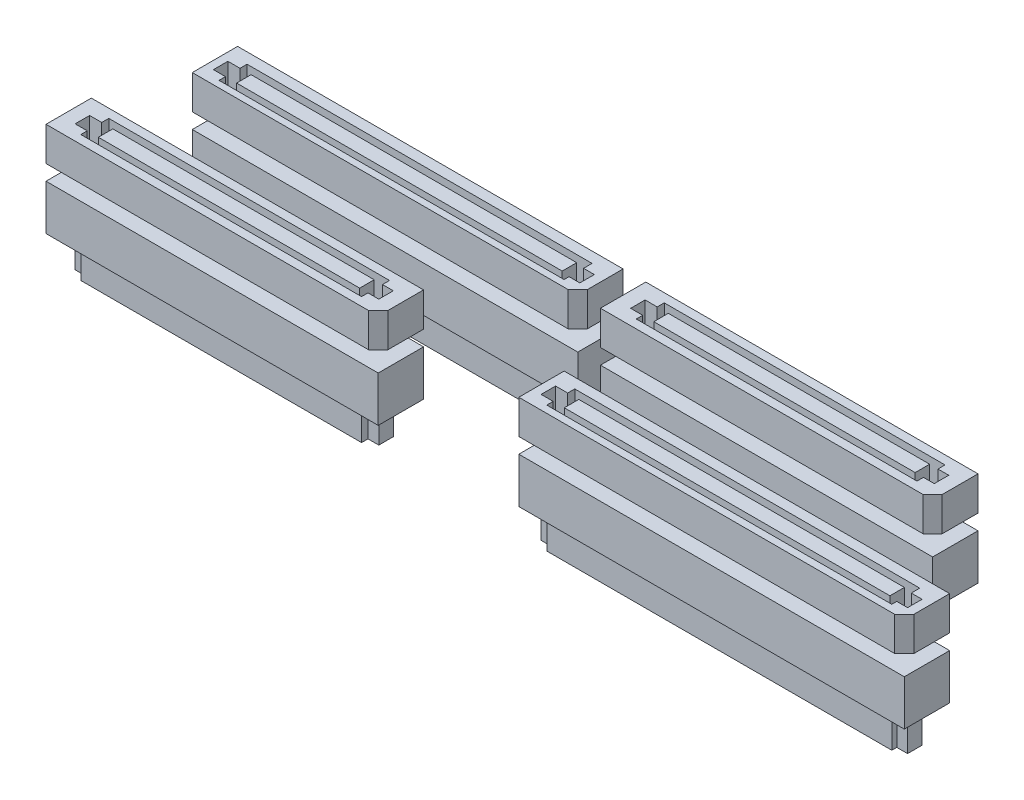
from build123d import *

# Parameters (mm, degrees)
SV_DEPTH           = 3.75
SV_2_DEPTH         = 3.75
SV_3_DEPTH         = 3.75
SV_4_DEPTH         = 3.75
SKETCH3_W          = 28.811718275
SKETCH3_H          = 1.597828601
SKETCH3_W_2        = 35.897762959
SKETCH3_W_3        = 35.897762958
CUT_EXTRUDE1_DEPTH = 3.5
SV4_A_DEPTH        = 5
SV4_A_2_DEPTH      = 5
SV4_A_3_DEPTH      = 5
SV4_A_4_DEPTH      = 5
SKETCH7_W          = 35.897762958
SKETCH7_H          = 1.597828601
SKETCH7_W_2        = 28.811718275
SKETCH7_W_3        = 35.897762959
SV4_B_DEPTH        = 3.5


with BuildPart() as part:
    # Sketch1 → SV (new body)
    with BuildSketch(Plane(origin=(0, 0, 0), x_dir=(1, 0, 0), z_dir=(0, 1, 0))):
        Polygon((55.811, 9.5), (97.25, 9.5), (97.25, 5.56), (96.19, 4.5), (54.75, 4.5), (54.75, 8.439), (54.75, 9.5), align=None)
    extrude(amount=SV_DEPTH)


with BuildPart() as body_2:
    # Sketch1 → SV 2 (new body)
    with BuildSketch(Plane(origin=(0, 0, 0), x_dir=(1, 0, 0), z_dir=(0, 1, 0))):
        Polygon((3.686, 9.5), (39.25, 9.5), (39.25, 5.555), (38.195, 4.5), (2.625, 4.5), (2.625, 8.439), (2.625, 9.5), align=None)
    extrude(amount=SV_2_DEPTH)


with BuildPart() as body_3:
    # Sketch1 → SV 3 (new body)
    with BuildSketch(Plane(origin=(0, 0, 0), x_dir=(1, 0, 0), z_dir=(0, 1, 0))):
        Polygon((51.811, 22.5), (87.375, 22.5), (87.375, 18.555), (86.32, 17.5), (50.75, 17.5), (50.75, 21.439), (50.75, 22.5), align=None)
    extrude(amount=SV_3_DEPTH)


with BuildPart() as body_4:
    # Sketch1 → SV 4 (new body)
    with BuildSketch(Plane(origin=(0, 0, 0), x_dir=(1, 0, 0), z_dir=(0, 1, 0))):
        Polygon((6.811, 22.5), (48.25, 22.5), (48.25, 18.56), (47.19, 17.5), (5.75, 17.5), (5.75, 21.439), (5.75, 22.5), align=None)
    extrude(amount=SV_4_DEPTH)


with BuildPart() as cut_extrude1_tool:
    # Sketch3 → Cut-Extrude1 (new body)
    # profile 1 of 4: a face of its own
    with BuildSketch(Plane(origin=(0, 3.75, 0), x_dir=(1, 0, 0), z_dir=(0, 1, 0))):
        Polygon((4.189336253, 7.745735487), (5.524337048, 7.745735487), (5.524337048, 8.524173538), (36.475691419, 8.524173538), (36.475691419, 7.745735487), (37.666991912, 7.745735487), (37.666991912, 6.147906886), (36.475691419, 6.147906886), (36.475691419, 5.438560322), (5.524337048, 5.438560322), (5.524337048, 6.147906886), (4.189336253, 6.147906886), align=None)
        with Locations((21.152985591, 6.946821187)):
            Rectangle(SKETCH3_W, SKETCH3_H, mode=Mode.SUBTRACT)
    # profile 2 of 4: a face of its own
    with BuildSketch(Plane(origin=(0, 3.75, 0), x_dir=(1, 0, 0), z_dir=(0, 1, 0))):
        Polygon((52.421116037, 20.753597434), (53.756116831, 20.753597434), (53.756116831, 21.532035485), (84.707471203, 21.532035485), (84.707471203, 20.753597434), (85.898771695, 20.753597434), (85.898771695, 19.155768833), (84.707471203, 19.155768833), (84.707471203, 18.446422269), (53.756116831, 18.446422269), (53.756116831, 19.155768833), (52.421116037, 19.155768833), align=None)
        with Locations((69.384765375, 19.954683133)):
            Rectangle(SKETCH3_W, SKETCH3_H, mode=Mode.SUBTRACT)
    # profile 3 of 4: a face of its own
    with BuildSketch(Plane(origin=(0, 3.75, 0), x_dir=(1, 0, 0), z_dir=(0, 1, 0))):
        Polygon((55.705906871, 7.599031898), (57.040907666, 7.599031898), (57.040907666, 8.377469948), (95.07830672, 8.377469948), (95.07830672, 7.437727621), (96.269607213, 7.437727621), (96.269607213, 5.83989902), (95.07830672, 5.83989902), (95.07830672, 5.291856733), (57.040907666, 5.291856733), (57.040907666, 6.001203297), (55.705906871, 6.001203297), align=None)
        with Locations((76.21257855, 6.800117597)):
            Rectangle(SKETCH3_W_2, SKETCH3_H, mode=Mode.SUBTRACT)
    # profile 4 of 4: a face of its own
    with BuildSketch(Plane(origin=(0, 3.75, 0), x_dir=(1, 0, 0), z_dir=(0, 1, 0))):
        Polygon((6.636601859, 20.53972103), (7.971602653, 20.53972103), (7.971602653, 21.318159081), (46.009001708, 21.318159081), (46.009001708, 20.378416754), (47.2003022, 20.378416754), (47.2003022, 18.780588153), (46.009001708, 18.780588153), (46.009001708, 18.232545866), (7.971602653, 18.232545866), (7.971602653, 18.941892429), (6.636601859, 18.941892429), align=None)
        with Locations((27.143273538, 19.74080673)):
            Rectangle(SKETCH3_W_3, SKETCH3_H, mode=Mode.SUBTRACT)
    extrude(amount=-CUT_EXTRUDE1_DEPTH)


with BuildPart() as part_1:
    add(part.part)

    # Cut-Extrude1: cut by cut_extrude1_tool
    add(cut_extrude1_tool.part, mode=Mode.SUBTRACT)


with BuildPart() as body_2_1:
    add(body_2.part)

    # Cut-Extrude1: cut by cut_extrude1_tool
    add(cut_extrude1_tool.part, mode=Mode.SUBTRACT)


with BuildPart() as body_3_1:
    add(body_3.part)

    # Cut-Extrude1: cut by cut_extrude1_tool
    add(cut_extrude1_tool.part, mode=Mode.SUBTRACT)


with BuildPart() as body_4_1:
    add(body_4.part)

    # Cut-Extrude1: cut by cut_extrude1_tool
    add(cut_extrude1_tool.part, mode=Mode.SUBTRACT)


with BuildPart() as body_5:
    # Sketch6 → SV4(a) (new body)
    with BuildSketch(Plane(origin=(0, -1.68656, 0), x_dir=(1, 0, 0), z_dir=(0, 1, 0))):
        Polygon((2.625, 4.5), (38.195, 4.5), (39.25, 4.5), (39.25, 5.555), (39.25, 9.5), (3.685, 9.5), (2.625, 8.44), align=None)
    extrude(amount=-SV4_A_DEPTH)



with BuildPart() as body_6:
    # Sketch6 → SV4_a 2 (new body)
    with BuildSketch(Plane(origin=(0, -1.68656, 0), x_dir=(1, 0, 0), z_dir=(0, 1, 0))):
        Polygon((48.25, 18.56191605), (48.25, 22.5), (6.81, 22.5), (5.75, 21.44), (5.75, 17.5), (47.18808395, 17.5), (48.25, 17.5), align=None)
    extrude(amount=-SV4_A_2_DEPTH)


with BuildPart() as body_7:
    # Sketch6 → SV4_a 3 (new body)
    with BuildSketch(Plane(origin=(0, -1.68656, 0), x_dir=(1, 0, 0), z_dir=(0, 1, 0))):
        Polygon((54.75, 4.5), (96.19, 4.5), (97.25, 4.5), (97.25, 5.56), (97.25, 9.5), (55.81, 9.5), (54.75, 8.44), align=None)
    extrude(amount=-SV4_A_3_DEPTH)


with BuildPart() as body_8:
    # Sketch6 → SV4_a 4 (new body)
    with BuildSketch(Plane(origin=(0, -1.68656, 0), x_dir=(1, 0, 0), z_dir=(0, 1, 0))):
        Polygon((50.75, 17.5), (86.32, 17.5), (87.375, 17.5), (87.375, 18.555), (87.375, 22.5), (51.805, 22.5), (50.75, 21.445), align=None)
    extrude(amount=-SV4_A_4_DEPTH)


with BuildPart() as body_5_1:
    add(body_5.part)

    add(body_6.part)  # SV4(b) merges body 6

    add(body_7.part)  # SV4(b) merges body 7

    add(body_8.part)  # SV4(b) merges body 8
    # Sketch7 → SV4(b) (add)
    # profile 1 of 4: a face of its own
    with BuildSketch(Plane.XZ.offset(6.68656)):
        Polygon((7.971602653, -21.318159081), (7.971602653, -20.53972103), (6.636601859, -20.53972103), (6.636601859, -18.941892429), (7.971602653, -18.941892429), (7.971602653, -18.232545866), (46.009001708, -18.232545866), (46.009001708, -18.780588153), (47.2003022, -18.780588153), (47.2003022, -20.378416754), (46.009001708, -20.378416754), (46.009001708, -21.318159081), align=None)
        with Locations((27.143273538, -19.74080673)):
            Rectangle(SKETCH7_W, SKETCH7_H, mode=Mode.SUBTRACT)
    # profile 2 of 4: a face of its own
    with BuildSketch(Plane.XZ.offset(6.68656)):
        Polygon((53.756116831, -21.532035485), (84.707471203, -21.532035485), (84.707471203, -20.753597434), (85.898771695, -20.753597434), (85.898771695, -19.155768833), (84.707471203, -19.155768833), (84.707471203, -18.446422269), (53.756116831, -18.446422269), (53.756116831, -19.155768833), (52.421116037, -19.155768833), (52.421116037, -20.753597434), (53.756116831, -20.753597434), align=None)
        with Locations((69.384765375, -19.954683133)):
            Rectangle(SKETCH7_W_2, SKETCH7_H, mode=Mode.SUBTRACT)
    # profile 3 of 4: a face of its own
    with BuildSketch(Plane.XZ.offset(6.68656)):
        Polygon((57.040907666, -8.377469948), (57.040907666, -7.599031898), (55.705906871, -7.599031898), (55.705906871, -6.001203297), (57.040907666, -6.001203297), (57.040907666, -5.291856733), (95.07830672, -5.291856733), (95.07830672, -5.83989902), (96.269607213, -5.83989902), (96.269607213, -7.437727621), (95.07830672, -7.437727621), (95.07830672, -8.377469948), align=None)
        with Locations((76.21257855, -6.800117597)):
            Rectangle(SKETCH7_W_3, SKETCH7_H, mode=Mode.SUBTRACT)
    # profile 4 of 4: a face of its own
    with BuildSketch(Plane.XZ.offset(6.68656)):
        Polygon((4.189336253, -6.147906886), (5.524337048, -6.147906886), (5.524337048, -5.438560322), (36.475691419, -5.438560322), (36.475691419, -6.147906886), (37.666991912, -6.147906886), (37.666991912, -7.745735487), (36.475691419, -7.745735487), (36.475691419, -8.524173538), (5.524337048, -8.524173538), (5.524337048, -7.745735487), (4.189336253, -7.745735487), align=None)
        with Locations((21.152985591, -6.946821187)):
            Rectangle(SKETCH7_W_2, SKETCH7_H, mode=Mode.SUBTRACT)
    extrude(amount=SV4_B_DEPTH)


solid = Compound([part_1.part, body_2_1.part, body_3_1.part, body_4_1.part, body_5_1.part])
